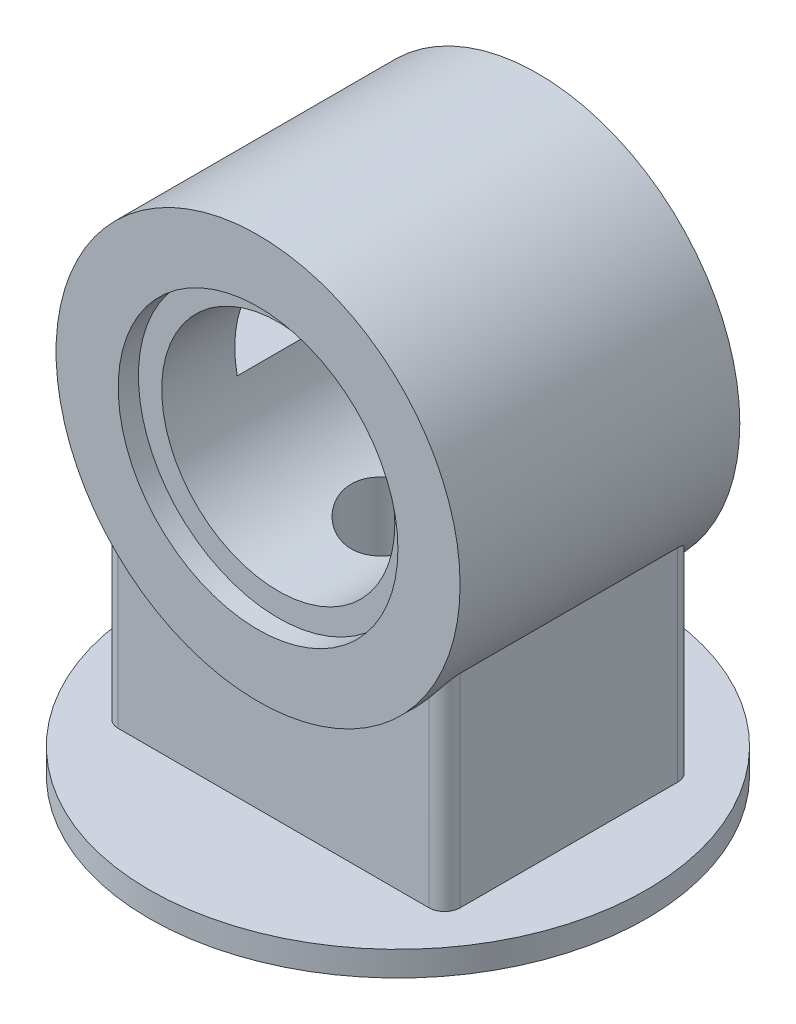
from build123d import *

# Parameters (mm, degrees)
SKETCH_1_R          = 35
SKETCH_1_R_2        = 2
EXTRUDE_1_DEPTH     = 7
SKETCH_2_R          = 160
EXTRUDE_2_DEPTH     = 16
SKETCH_3_R          = 130
SKETCH_3_R_2        = 75
EXTRUDE_4_DEPTH     = 90
EXTRUDE_5_REACH     = 402.125
SKETCH_4_W          = 220
SKETCH_4_H          = 160
FILLET_1_R          = 10
CUT_EXTRUDE_START   = -30
SKETCH_5_R          = 30
CUT_EXTRUDE_1_DEPTH = 220
SKETCH_6_R          = 2
CUT_EXTRUDE_2_DEPTH = 220
SKETCH_7_R          = 80
SKETCH_7_R_2        = 28
EXTRUDE_1_2_DEPTH   = 2
SKETCH_8_R          = 90
CUT_EXTRUDE_3_DEPTH = 13
SKETCH_9_R          = 5
CUT_EXTRUDE_4_DEPTH = 30
SKETCH_10_W         = 60
SKETCH_10_H         = 60
CUT_EXTRUDE_5_DEPTH = 170


with BuildPart() as part:
    # 草图1 → Extrude 1 (new body)
    with BuildSketch(Plane(origin=(0, 0, 0), x_dir=(1, 0, 0), z_dir=(0, 1, 0))):
        Circle(SKETCH_1_R)
        with Locations((0, 17.25)):
            Circle(SKETCH_1_R_2, mode=Mode.SUBTRACT)
        with Locations((14.938938215, 8.625)):
            Circle(SKETCH_1_R_2, mode=Mode.SUBTRACT)
        with Locations((14.938938215, -8.625)):
            Circle(SKETCH_1_R_2, mode=Mode.SUBTRACT)
        with Locations((0, -17.25)):
            Circle(SKETCH_1_R_2, mode=Mode.SUBTRACT)
        with Locations((-14.938938215, -8.625)):
            Circle(SKETCH_1_R_2, mode=Mode.SUBTRACT)
        with Locations((-14.938938215, 8.625)):
            Circle(SKETCH_1_R_2, mode=Mode.SUBTRACT)
    extrude(amount=EXTRUDE_1_DEPTH)

    # 草图2 → 凸台-拉伸2 (add)
    with BuildSketch(Plane(origin=(0, 7, 0), x_dir=(1, 0, 0), z_dir=(0, 1, 0))):
        Circle(SKETCH_2_R)
    extrude(amount=EXTRUDE_2_DEPTH)


with BuildPart() as body_2:
    # 草图3 → 凸台-拉伸4 (new, symmetric)
    with BuildSketch(Plane.XY):
        with Locations((0, 223)):
            Circle(SKETCH_3_R)
        with Locations((0, 223)):
            Circle(SKETCH_3_R_2, mode=Mode.SUBTRACT)
    extrude(amount=EXTRUDE_4_DEPTH, both=True)

    # 草图4 → 凸台-拉伸5 (add, up to next)
    with BuildSketch(Plane(origin=(0, 23, 0), x_dir=(1, 0, 0), z_dir=(0, 1, 0)), mode=Mode.PRIVATE) as extrude_5_sk1:
        Rectangle(SKETCH_4_W, SKETCH_4_H)
    extrude_5_tool1 = extrude(extrude_5_sk1.sketch, amount=EXTRUDE_5_REACH, mode=Mode.PRIVATE) - body_2.part

    add(part.part)  # 凸台-拉伸5 merges part
    add(extrude_5_tool1.solids().sort_by_distance((0, 23, 0))[0])

    # 圆角1
    fillet_1_edges = [body_2.edges().sort_by_distance(p)[0] for p in [
        (-110, 88.358983849, -80),
        (110, 88.358983849, -80),
        (110, 88.358983849, 80),
        (-110, 88.358983849, 80),
    ]]
    fillet(fillet_1_edges, radius=FILLET_1_R)

    # 草图5 → 切除-拉伸1 (cut)
    with BuildSketch(Plane.XZ.offset(CUT_EXTRUDE_START)):
        Circle(SKETCH_5_R)
    extrude(amount=-CUT_EXTRUDE_1_DEPTH, mode=Mode.SUBTRACT)

    # 草图6 → 切除-拉伸2 (cut)
    with BuildSketch(Plane.XZ):
        with Locations((0, 17.25)):
            Circle(SKETCH_6_R)
        with Locations((14.938938215, 8.625)):
            Circle(SKETCH_6_R)
        with Locations((14.938938215, -8.625)):
            Circle(SKETCH_6_R)
        with Locations((0, -17.25)):
            Circle(SKETCH_6_R)
        with Locations((-14.938938215, -8.625)):
            Circle(SKETCH_6_R)
        with Locations((-14.938938215, 8.625)):
            Circle(SKETCH_6_R)
    extrude(amount=-CUT_EXTRUDE_2_DEPTH, mode=Mode.SUBTRACT)

    # 草图7 → Extrude 1 2 (add)
    with BuildSketch(Plane.XZ.offset(-7)):
        Circle(SKETCH_7_R)
        Circle(SKETCH_7_R_2, mode=Mode.SUBTRACT)
    extrude(amount=EXTRUDE_1_2_DEPTH)

    # 草图8 → 切除-拉伸3 (cut)
    with BuildSketch(Plane.XY.offset(90)):
        with Locations((0, 223)):
            Circle(SKETCH_8_R)
    extrude(amount=-CUT_EXTRUDE_3_DEPTH, mode=Mode.SUBTRACT)

    # 草图9 → 切除-拉伸4 (cut)
    with BuildSketch(Plane(origin=(0, 0, -90), x_dir=(-1, 0, 0), z_dir=(0, 0, -1))):
        with Locations((0, 323)):
            Circle(SKETCH_9_R)
        with Locations((50, 309.602540378)):
            Circle(SKETCH_9_R)
        with Locations((86.602540378, 273)):
            Circle(SKETCH_9_R)
        with Locations((100, 223)):
            Circle(SKETCH_9_R)
        with Locations((86.602540378, 173)):
            Circle(SKETCH_9_R)
        with Locations((50, 136.397459622)):
            Circle(SKETCH_9_R)
        with Locations((0, 123)):
            Circle(SKETCH_9_R)
        with Locations((-50, 136.397459622)):
            Circle(SKETCH_9_R)
        with Locations((-86.602540378, 173)):
            Circle(SKETCH_9_R)
        with Locations((-100, 223)):
            Circle(SKETCH_9_R)
        with Locations((-86.602540378, 273)):
            Circle(SKETCH_9_R)
        with Locations((-50, 309.602540378)):
            Circle(SKETCH_9_R)
    extrude(amount=-CUT_EXTRUDE_4_DEPTH, mode=Mode.SUBTRACT)

    # 草图10 → 切除-拉伸5 (cut)
    with BuildSketch(Plane(origin=(0, 0, 0), x_dir=(0, 0, -1), z_dir=(1, 0, 0))):
        with Locations((0, 237.738025303)):
            Rectangle(SKETCH_10_W, SKETCH_10_H)
    extrude(amount=-CUT_EXTRUDE_5_DEPTH, mode=Mode.SUBTRACT)


solid = body_2.part
